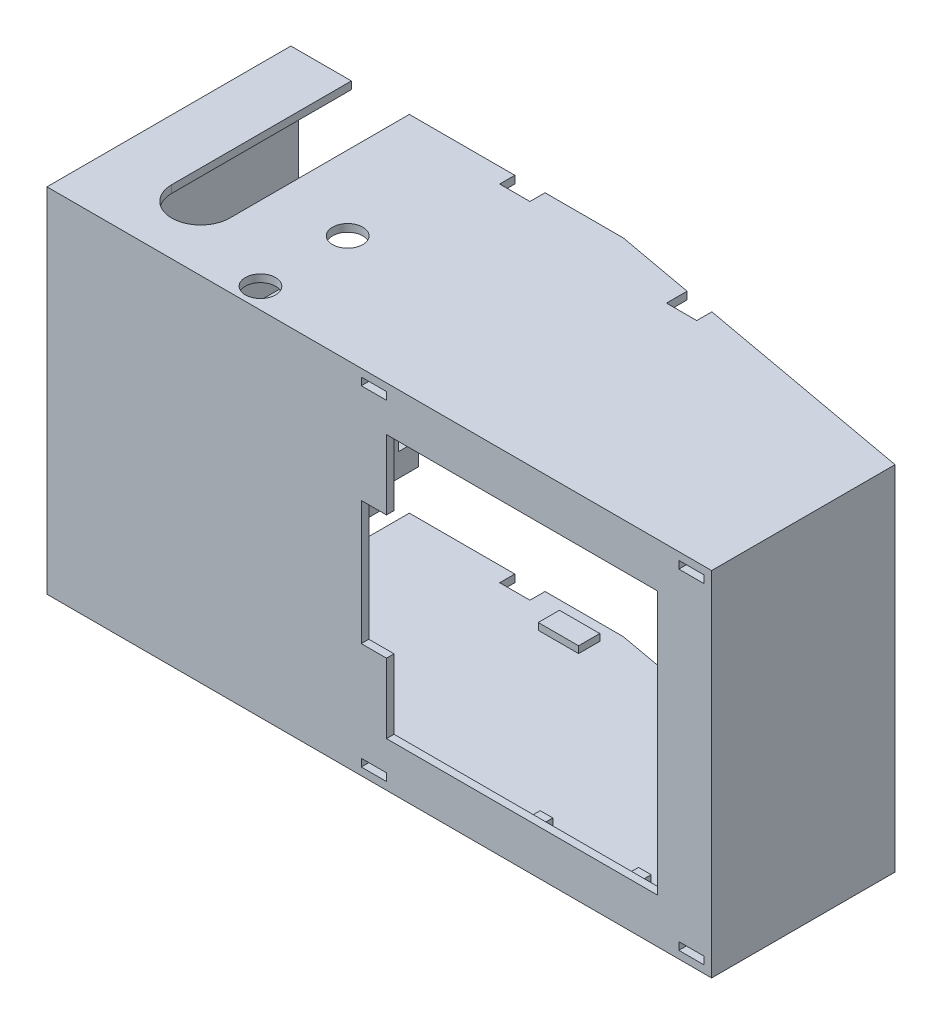
from build123d import *

# Parameters (mm, degrees)
SKETCH1_W                 = 131.85
SKETCH1_H                 = 70
BOSS_EXTRUDE1_DEPTH       = 1.5
SKETCH1_5_W               = 131.85
SKETCH1_5_H               = 70
SKETCH1_5_W_2             = 128.85
SKETCH1_5_H_2             = 67
BOSS_EXTRUDE2_DEPTH       = 46.887495374
SKETCH2_W                 = 5.8
SKETCH2_H                 = 7.525
BOSS_EXTRUDE3_DEPTH       = 67
CAVITY1_START             = -114.930353249
CAVITY1_DEPTH             = 49.266
CAVITY1_2_DEPTH           = 37.332
CAVITY1_START_2           = -120.030353249
CAVITY1_3_OUTLINE_W       = 2.55
CAVITY1_3_OUTLINE_H       = 5.1
CAVITY1_3_DEPTH           = 0.430353249
CAVITY1_START_3           = -9.75
CAVITY1_4_DEPTH           = 70
SKETCH5_W                 = 8.75
SKETCH5_H                 = 5
BOSS_EXTRUDE4_DEPTH       = 22.5
CUT_EXTRUDE3_REACH        = 139.739
SKETCH6_R                 = 1.5
SKETCH6_R_2               = 1
CUT_EXTRUDE18_DEPTH       = 1.15
CUT_EXTRUDE18_DEPTH_BACK  = 1.15
CUT_EXTRUDE18_START       = -2.5
CUT_EXTRUDE19_DEPTH       = 1.15
CUT_EXTRUDE19_DEPTH_BACK  = 1.15
CUT_EXTRUDE19_START       = -19.7
SKETCH9_W                 = 32.1
SKETCH9_H                 = 12.2
SKETCH9_W_2               = 2.6125
BOSS_EXTRUDE5_DEPTH       = 40.087495374
SKETCH10_W                = 22.5
SKETCH10_H                = 15.7
CUT_EXTRUDE6_DEPTH        = 12.2
SKETCH11_R                = 0.75
CUT_EXTRUDE7_DEPTH        = 8
CUT_EXTRUDE9_REACH        = 149.525
SKETCH17_W                = 3.1875
SKETCH17_H                = 12.2
CUT_EXTRUDE13_DEPTH       = 7.525
SKETCH20_W                = 2.5
SKETCH20_H                = 3
BOSSBATTERYSTUBS_DEPTH    = 5.75
MIRROR10_COPY_1_SKETCH_W  = 2.5
MIRROR10_COPY_1_SKETCH_H  = 3
MIRROR10_COPY_1_DEPTH     = 5.75
SKETCH21_W                = 8
SKETCH21_H                = 4.2
BODYTOPCANTPOSBOSS_DEPTH  = 1.35
MIRROR12_COPY_1_SKETCH_W  = 8
MIRROR12_COPY_1_SKETCH_H  = 4.2
MIRROR12_COPY_1_DEPTH     = 1.35
PCBHOLDERCANTNEGCUT_REACH = 145.655
SKETCH22_W                = 5
SKETCH22_H                = 1.5
SKETCH23_W                = 5
SKETCH23_H                = 1.5
CUT_EXTRUDE17_DEPTH       = 3
PCBHOLDERACCESSCUT_REACH  = 145.156
CUT_EXTRUDE15_START       = -5.25
SKETCH19_R                = 3
CUT_EXTRUDE15_DEPTH       = 5.25
CUT_EXTRUDE24_START       = -5.25
SKETCH28_R                = 3
CUT_EXTRUDE24_DEPTH       = 5.25
CUT_EXTRUDE25_REACH       = 118.492
SKETCH29_W                = 8
SKETCH29_H                = 3
SKETCH30_W                = 5.1
SKETCH30_H                = 2.55
BOSSFRONTCAVITYFIX_DEPTH  = 0.430353249
CUT_EXTRUDE26_DEPTH       = 4.8
CUT_EXTRUDE28_REACH       = 154.358
SKETCH33_W                = 3
SKETCH33_H                = 20
BODYTOPCVCUT_DEPTH        = 148.525073199
ATTACHMENTSIDECUT_REACH   = 149.525
SKETCH32_W                = 6
SKETCH32_H                = 3


# Read off the part's stored shape, not the designer's step: Cavity1
with BuildPart() as part:
    # Sketch1 → Boss-Extrude1 (new body)
    with BuildSketch(Plane.XY):
        with Locations((-55.175, 25.25)):
            Rectangle(SKETCH1_W, SKETCH1_H)
    extrude(amount=BOSS_EXTRUDE1_DEPTH)

    # Sketch1<5> → Boss-Extrude2 (add)
    with BuildSketch(Plane.XY):
        with Locations((-55.175, 25.25)):
            Rectangle(SKETCH1_5_W, SKETCH1_5_H)
        with Locations((-55.175, 25.25)):
            Rectangle(SKETCH1_5_W_2, SKETCH1_5_H_2, mode=Mode.SUBTRACT)
    extrude(amount=-BOSS_EXTRUDE2_DEPTH)

    # Sketch2 → Boss-Extrude3 (add)
    with BuildSketch(Plane.XZ.offset(-58.75)):
        with Locations((-76.95, -3.7625)):
            Rectangle(SKETCH2_W, SKETCH2_H)
    extrude(amount=BOSS_EXTRUDE3_DEPTH)

    # Cavity1 outline → Cavity1 (cut)
    with BuildSketch(Plane.YZ.offset(CAVITY1_START)):
        with BuildLine():
            Line((36.166540929, -4.011412776), (36.166540929, -7.525))
            Line((36.166540929, -7.525), (53.710540929, -7.525))
            Line((53.710540929, -7.525), (53.710540929, -4.011412776))
            ThreePointArc((53.710540929, -4.011412776), (44.938540929, 0.123), (36.166540929, -4.011412776))
        make_face()
        with BuildLine():
            Line((14.333459071, -7.525), (14.333459071, -4.011412776))
            ThreePointArc((14.333459071, -4.011412776), (5.561459071, 0.123), (-3.210540929, -4.011412776))
            Line((-3.210540929, -4.011412776), (-3.210540929, -7.525))
            Line((-3.210540929, -7.525), (14.333459071, -7.525))
        make_face()
    extrude(amount=CAVITY1_DEPTH, mode=Mode.SUBTRACT)

    # Cavity1 2 outline → Cavity1 2 (cut)
    with BuildSketch(Plane.YZ.offset(CAVITY1_START)):
        with BuildLine():
            Line((55.189540929, 0.225), (36.166540929, 0.225))
            Line((36.166540929, 0.225), (36.166540929, -4.011412776))
            ThreePointArc((36.166540929, -4.011412776), (44.938540929, 0.123), (53.710540929, -4.011412776))
            Line((53.710540929, -4.011412776), (53.710540929, -7.525))
            Line((53.710540929, -7.525), (55.189540929, -7.525))
            Line((55.189540929, -7.525), (55.189540929, 0.225))
        make_face()
        with BuildLine():
            Line((14.333459071, -4.011412776), (14.333459071, 0.225))
            Line((14.333459071, 0.225), (-4.689540929, 0.225))
            Line((-4.689540929, 0.225), (-4.689540929, -7.525))
            Line((-4.689540929, -7.525), (-3.210540929, -7.525))
            Line((-3.210540929, -7.525), (-3.210540929, -4.011412776))
            ThreePointArc((-3.210540929, -4.011412776), (5.561459071, 0.123), (14.333459071, -4.011412776))
        make_face()
    extrude(amount=CAVITY1_2_DEPTH, mode=Mode.SUBTRACT)

    # Cavity1 3 outline → Cavity1 3 (cut)
    with BuildSketch(Plane.YZ.offset(CAVITY1_START_2)):
        with Locations((44.938540929, -11.25)):
            Rectangle(CAVITY1_3_OUTLINE_W, CAVITY1_3_OUTLINE_H)
        with Locations((5.561459071, -11.25)):
            Rectangle(CAVITY1_3_OUTLINE_W, CAVITY1_3_OUTLINE_H)
    extrude(amount=CAVITY1_3_DEPTH, mode=Mode.SUBTRACT)

    # Cavity1 4 outline → Cavity1 4 (cut)
    with BuildSketch(Plane(origin=(0, 0, 0), x_dir=(1, 0, 0), z_dir=(0, 1, 0)).offset(CAVITY1_START_3)):
        with BuildLine():
            Line((-105.571853249, 13.174532151), (-105.571853249, 9.325467849))
            ThreePointArc((-105.571853249, 9.325467849), (-103.710353249, 8.5725), (-101.848853249, 9.325467849))
            Line((-101.848853249, 9.325467849), (-101.848853249, 13.174532151))
            ThreePointArc((-101.848853249, 13.174532151), (-103.710353249, 13.9275), (-105.571853249, 13.174532151))
        make_face()
    extrude(amount=CAVITY1_4_DEPTH, mode=Mode.SUBTRACT)

    # Sketch5 → Boss-Extrude4 (add)
    with BuildSketch(Plane(origin=(0, 0, 0), x_dir=(-1, 0, 0), z_dir=(0, 0, -1))):
        with Locations((82.85, 33.85)):
            Rectangle(SKETCH5_W, SKETCH5_H)
    boss_extrude4 = extrude(amount=BOSS_EXTRUDE4_DEPTH)

    # Sketch6 → Cut-Extrude3 (cut, up to next)
    with BuildSketch(Plane(origin=(0, 36.166540929, 0), x_dir=(1, 0, 0), z_dir=(0, 1, 0)), mode=Mode.PRIVATE) as cut_extrude3_sk1:
        with Locations(Location((-82.85, 19.9, 0), (0, 0, 270))):
            Circle(SKETCH6_R)
    cut_extrude3_tool1 = extrude(cut_extrude3_sk1.sketch, amount=-CUT_EXTRUDE3_REACH, mode=Mode.PRIVATE) & part.part
    # Sketch6 → Cut-Extrude3 (cut, up to next)
    with BuildSketch(Plane(origin=(0, 36.166540929, 0), x_dir=(1, 0, 0), z_dir=(0, 1, 0)), mode=Mode.PRIVATE) as cut_extrude3_sk2:
        with Locations(Location((-82.85, 2.6, 0), (0, 0, 270))):
            Circle(SKETCH6_R_2)
    cut_extrude3_tool2 = extrude(cut_extrude3_sk2.sketch, amount=-CUT_EXTRUDE3_REACH, mode=Mode.PRIVATE) & part.part
    cut_extrude3_1 = cut_extrude3_tool1.solids().sort_by_distance((-82.85, 36.166541, -19.9))[0]
    add(cut_extrude3_1, mode=Mode.SUBTRACT)
    cut_extrude3_2 = cut_extrude3_tool2.solids().sort_by_distance((-82.85, 36.166541, -2.6))[0]
    add(cut_extrude3_2, mode=Mode.SUBTRACT)
    cut_extrude3 = cut_extrude3_1 + cut_extrude3_2  # Cut-Extrude3 as one shape, for the pattern or mirror that repeats it

    # Sketch24 → Cut-Extrude18 (cut, two sides: drawn at the far end of the back side and taken through both)
    with BuildSketch(Plane(origin=(0, 36.35, 0), x_dir=(1, 0, 0), z_dir=(0, 1, 0)).offset(CUT_EXTRUDE18_START - CUT_EXTRUDE18_DEPTH_BACK)):
        Polygon((-82.85, 16.637970979), (-80.025, 18.26898549), (-80.025, 22.5), (-85.675, 22.5), (-85.675, 18.26898549), align=None)
    extrude(amount=CUT_EXTRUDE18_DEPTH + CUT_EXTRUDE18_DEPTH_BACK, mode=Mode.SUBTRACT)

    # Mirror15: Boss-Extrude4, Cut-Extrude3 across plane
    add(boss_extrude4.mirror(Plane(origin=(0, 25.25, 0), x_dir=(0, 0, 1), z_dir=(0, -1, 0))))
    add(cut_extrude3.mirror(Plane(origin=(0, 25.25, 0), x_dir=(0, 0, 1), z_dir=(0, -1, 0))), mode=Mode.SUBTRACT)

    # Sketch24<2> → Cut-Extrude19 (cut, two sides: drawn at the far end of the back side and taken through both)
    with BuildSketch(Plane(origin=(0, 36.35, 0), x_dir=(1, 0, 0), z_dir=(0, 1, 0)).offset(CUT_EXTRUDE19_START - CUT_EXTRUDE19_DEPTH_BACK)):
        Polygon((-82.85, 16.637970979), (-80.025, 18.26898549), (-80.025, 22.5), (-85.675, 22.5), (-85.675, 18.26898549), align=None)
    extrude(amount=CUT_EXTRUDE19_DEPTH + CUT_EXTRUDE19_DEPTH_BACK, mode=Mode.SUBTRACT)

    # Sketch9 → Boss-Extrude5 (add)
    with BuildSketch(Plane(origin=(0, 0, 0), x_dir=(-1, 0, 0), z_dir=(0, 0, -1))):
        with Locations((93.2875, 25.25)):
            Rectangle(SKETCH9_W, SKETCH9_H)
        with Locations((78.54375, 25.25)):
            Rectangle(SKETCH9_W_2, SKETCH9_H)
    extrude(amount=BOSS_EXTRUDE5_DEPTH)

    # Sketch10 → Cut-Extrude6 (cut)
    with BuildSketch(Plane(origin=(0, 31.35, 0), x_dir=(1, 0, 0), z_dir=(0, 1, 0))):
        with Locations((-93.2875, 32.237495374)):
            Rectangle(SKETCH10_W, SKETCH10_H)
    extrude(amount=-CUT_EXTRUDE6_DEPTH, mode=Mode.SUBTRACT)

    # Sketch11 → Cut-Extrude7 (cut)
    with BuildSketch(Plane(origin=(0, 0, -40.087495374), x_dir=(-1, 0, 0), z_dir=(0, 0, -1))):
        with Locations((106.9375, 25.25)):
            Circle(SKETCH11_R)
    cut_extrude7 = extrude(amount=-CUT_EXTRUDE7_DEPTH, mode=Mode.SUBTRACT)

    # Sketch13 → Cut-Extrude9 (cut, up to next)
    with BuildSketch(Plane(origin=(0, 60.25, 0), x_dir=(1, 0, 0), z_dir=(0, 1, 0)), mode=Mode.PRIVATE) as cut_extrude9_sk1:
        with BuildLine():
            Line((-109.1, 46.887495374), (-109.1, 11.25))
            ThreePointArc((-109.1, 11.25), (-103.35, 5.5), (-97.6, 11.25))
            Line((-97.6, 11.25), (-97.6, 46.887495374))
            Line((-97.6, 46.887495374), (-109.1, 46.887495374))
        make_face()
        with BuildLine():
            Line((-105.571853249, 9.325467849), (-105.571853249, 13.174532151))
            ThreePointArc((-105.571853249, 13.174532151), (-103.710353249, 13.9275), (-101.848853249, 13.174532151))
            Line((-101.848853249, 13.174532151), (-101.848853249, 9.325467849))
            ThreePointArc((-101.848853249, 9.325467849), (-103.710353249, 8.5725), (-105.571853249, 9.325467849))
        make_face(mode=Mode.SUBTRACT)
    cut_extrude9_tool1 = extrude(cut_extrude9_sk1.sketch, amount=-CUT_EXTRUDE9_REACH, mode=Mode.PRIVATE) & part.part
    cut_extrude9 = cut_extrude9_tool1.solids().sort_by_distance((-103.335225, 60.25, -27.427392))[0]
    add(cut_extrude9, mode=Mode.SUBTRACT)

    # Mirror4: Cut-Extrude9 across plane
    add(cut_extrude9.mirror(Plane(origin=(0, 25.25, 0), x_dir=(0, 0, 1), z_dir=(0, -1, 0))), mode=Mode.SUBTRACT)

    # Sketch17 → Cut-Extrude13 (cut)
    with BuildSketch(Plane(origin=(0, 0, -7.525), x_dir=(-1, 0, 0), z_dir=(0, 0, -1))):
        with Locations((75.64375, 25.25)):
            Rectangle(SKETCH17_W, SKETCH17_H)
    extrude(amount=-CUT_EXTRUDE13_DEPTH, mode=Mode.SUBTRACT)

    # Sketch20 → BossBatteryStubs (add)
    with BuildSketch(Plane(origin=(0, 0, 0), x_dir=(-1, 0, 0), z_dir=(0, 0, -1))):
        with Locations((29.25, 57.25)):
            Rectangle(SKETCH20_W, SKETCH20_H)
    bossbatterystubs = extrude(amount=BOSSBATTERYSTUBS_DEPTH)

    # Mirror9: BossBatteryStubs across plane
    add(bossbatterystubs.mirror(Plane.ZY.offset(19.5)))

    # Mirror10: BossBatteryStubs across plane
    add(bossbatterystubs.mirror(Plane(origin=(0, 25.25, 0), x_dir=(0, 0, 1), z_dir=(0, -1, 0))))

    # Mirror10 copy 1 sketch → Mirror10 copy 1 (add)
    with BuildSketch(Plane(origin=(-39, 50.5, 0), x_dir=(1, 0, 0), z_dir=(0, 0, -1))):
        with Locations((29.25, 57.25)):
            Rectangle(MIRROR10_COPY_1_SKETCH_W, MIRROR10_COPY_1_SKETCH_H)
    extrude(amount=MIRROR10_COPY_1_DEPTH)

    # Sketch21 → bodyTopCantPosBoss (add)
    with BuildSketch(Plane.XZ.offset(-58.75)):
        with Locations((-115.6, -41.637495374)):
            Rectangle(SKETCH21_W, SKETCH21_H)
    bodytopcantposboss = extrude(amount=BODYTOPCANTPOSBOSS_DEPTH)

    # Mirror11: bodyTopCantPosBoss across plane
    add(bodytopcantposboss.mirror(Plane(origin=(-88.1375, 0, 0), x_dir=(0, 0, 1), z_dir=(1, 0, 0))))

    # Mirror12: bodyTopCantPosBoss across plane
    add(bodytopcantposboss.mirror(Plane(origin=(0, 25.25, 0), x_dir=(0, 0, 1), z_dir=(0, -1, 0))))

    # Mirror12 copy 1 sketch → Mirror12 copy 1 (add)
    with BuildSketch(Plane(origin=(-176.275, -8.25, 0), x_dir=(-1, 0, 0), z_dir=(0, 1, 0))):
        with Locations((-115.6, -41.637495374)):
            Rectangle(MIRROR12_COPY_1_SKETCH_W, MIRROR12_COPY_1_SKETCH_H)
    extrude(amount=MIRROR12_COPY_1_DEPTH)

    # Sketch22 → pcbHolderCantNegCut (cut, up to next)
    with BuildSketch(Plane.XY.offset(1.5), mode=Mode.PRIVATE) as pcbholdercantnegcut_sk1:
        with Locations((6.75, 58)):
            Rectangle(SKETCH22_W, SKETCH22_H)
    pcbholdercantnegcut_tool1 = extrude(pcbholdercantnegcut_sk1.sketch, amount=-PCBHOLDERCANTNEGCUT_REACH, mode=Mode.PRIVATE) & part.part
    pcbholdercantnegcut = pcbholdercantnegcut_tool1.solids().sort_by_distance((6.75, 58, 1.5))[0]
    add(pcbholdercantnegcut, mode=Mode.SUBTRACT)

    # Sketch23 → Cut-Extrude17 (cut)
    with BuildSketch(Plane.XY.offset(1.5)):
        with Locations((-56.25, 58)):
            Rectangle(SKETCH23_W, SKETCH23_H)
    cut_extrude17 = extrude(amount=-CUT_EXTRUDE17_DEPTH, mode=Mode.SUBTRACT)

    # Mirror13: pcbHolderCantNegCut, Cut-Extrude17 across plane
    add(pcbholdercantnegcut.mirror(Plane(origin=(0, 25.25, 0), x_dir=(0, 0, 1), z_dir=(0, -1, 0))), mode=Mode.SUBTRACT)
    add(cut_extrude17.mirror(Plane(origin=(0, 25.25, 0), x_dir=(0, 0, 1), z_dir=(0, -1, 0))), mode=Mode.SUBTRACT)

    # Mirror14: Cut-Extrude7 across plane
    add(cut_extrude7.mirror(Plane(origin=(-93.2875, 0, 0), x_dir=(0, 0, 1), z_dir=(1, 0, 0))), mode=Mode.SUBTRACT)

    # Sketch27 → pcbHolderAccessCut (cut, up to next)
    with BuildSketch(Plane(origin=(0, 0, 0), x_dir=(-1, 0, 0), z_dir=(0, 0, -1)), mode=Mode.PRIVATE) as pcbholderaccesscut_sk1:
        Polygon((58.75, 37.55), (58.75, 12.95), (53.75, 12.95), (53.75, -0.875), (0, -0.875), (0, 51.375), (53.75, 51.375), (53.75, 37.55), align=None)
    pcbholderaccesscut_tool1 = extrude(pcbholderaccesscut_sk1.sketch, amount=-PCBHOLDERACCESSCUT_REACH, mode=Mode.PRIVATE) & part.part
    add(pcbholderaccesscut_tool1.solids().sort_by_distance((-28.107544, 25.25, 0))[0], mode=Mode.SUBTRACT)

    # Sketch19 → Cut-Extrude15 (cut)
    with BuildSketch(Plane.XZ.offset(9.75).offset(CUT_EXTRUDE15_START)):
        with Locations((-82.85, -19.9)):
            Circle(SKETCH19_R)
        with Locations((-82.85, -2.6)):
            Circle(SKETCH19_R)
    extrude(amount=CUT_EXTRUDE15_DEPTH, mode=Mode.SUBTRACT)

    # Sketch28 → Cut-Extrude24 (cut)
    with BuildSketch(Plane(origin=(0, 60.25, 0), x_dir=(1, 0, 0), z_dir=(0, 1, 0)).offset(CUT_EXTRUDE24_START)):
        with Locations((-82.85, 19.9)):
            Circle(SKETCH28_R)
        with Locations((-82.85, 2.6)):
            Circle(SKETCH28_R)
    extrude(amount=CUT_EXTRUDE24_DEPTH, mode=Mode.SUBTRACT)

    # Sketch29 → Cut-Extrude25 (cut, up to next)
    with BuildSketch(Plane(origin=(-77.2375, 0, 0), x_dir=(0, 0, -1), z_dir=(1, 0, 0)), mode=Mode.PRIVATE) as cut_extrude25_sk1:
        with Locations((28.387495374, 25.25)):
            Rectangle(SKETCH29_W, SKETCH29_H)
    cut_extrude25_tool1 = extrude(cut_extrude25_sk1.sketch, amount=-CUT_EXTRUDE25_REACH, mode=Mode.PRIVATE) & part.part
    add(cut_extrude25_tool1.solids().sort_by_distance((-77.2375, 25.25, -28.387495))[0], mode=Mode.SUBTRACT)

    # Sketch30 → BossFrontCavityFix (add)
    with BuildSketch(Plane(origin=(-120.030353249, 0, 0), x_dir=(0, 0, -1), z_dir=(1, 0, 0))):
        with Locations((11.25, 44.938540929)):
            Rectangle(SKETCH30_W, SKETCH30_H)
        with Locations((11.25, 5.561459071)):
            Rectangle(SKETCH30_W, SKETCH30_H)
    extrude(amount=BOSSFRONTCAVITYFIX_DEPTH)

    # Sketch31 → Cut-Extrude26 (cut)
    with BuildSketch(Plane(origin=(-77.2375, 0, 0), x_dir=(0, 0, -1), z_dir=(1, 0, 0))):
        Polygon((40.087495374, 19.15), (28.387495374, 19.15), (28.387495374, 23.75), (28.387495374, 26.75), (28.387495374, 31.35), (40.087495374, 31.35), align=None)
    extrude(amount=-CUT_EXTRUDE26_DEPTH, mode=Mode.SUBTRACT)

    # Sketch33 → Cut-Extrude28 (cut, up to next)
    with BuildSketch(Plane(origin=(10.75, 0, 0), x_dir=(0, 0, -1), z_dir=(1, 0, 0)), mode=Mode.PRIVATE) as cut_extrude28_sk1:
        with Locations((45.387495374, 25.25)):
            Rectangle(SKETCH33_W, SKETCH33_H)
    cut_extrude28_tool1 = extrude(cut_extrude28_sk1.sketch, amount=-CUT_EXTRUDE28_REACH, mode=Mode.PRIVATE) & part.part
    cut_extrude28 = cut_extrude28_tool1.solids().sort_by_distance((10.75, 25.25, -45.387495))[0]
    add(cut_extrude28, mode=Mode.SUBTRACT)

    # Mirror17: Cut-Extrude28 across plane
    add(cut_extrude28.mirror(Plane(origin=(-55.175, 0, 0), x_dir=(0, 0, 1), z_dir=(1, 0, 0))), mode=Mode.SUBTRACT)

    # Sketch35 → bodyTopCVCut (cut, through all)
    with BuildSketch(Plane(origin=(0, 60.25, 0), x_dir=(1, 0, 0), z_dir=(0, 1, 0))):
        Polygon((-55.175, 46.887495374), (10.75, 34.887495374), (10.75, 46.887495374), align=None)
    extrude(amount=-BODYTOPCVCUT_DEPTH, mode=Mode.SUBTRACT)

    # Sketch32 → attachmentSideCut (cut, up to next)
    with BuildSketch(Plane.XZ.offset(9.75), mode=Mode.PRIVATE) as attachmentsidecut_sk1:
        with Locations((-73.675, -45.387495374)):
            Rectangle(SKETCH32_W, SKETCH32_H)
    attachmentsidecut_tool1 = extrude(attachmentsidecut_sk1.sketch, amount=-ATTACHMENTSIDECUT_REACH, mode=Mode.PRIVATE) & part.part
    # Sketch32 → attachmentSideCut (cut, up to next)
    with BuildSketch(Plane.XZ.offset(9.75), mode=Mode.PRIVATE) as attachmentsidecut_sk2:
        Polygon((-33.675, -42.973957262), (-33.675, -39.973957262), (-39.675, -39.973957262), (-39.675, -42.973957262), (-39.675, -44.066107433), align=None)
    attachmentsidecut_tool2 = extrude(attachmentsidecut_sk2.sketch, amount=-ATTACHMENTSIDECUT_REACH, mode=Mode.PRIVATE) & part.part
    attachmentsidecut_1 = attachmentsidecut_tool1.solids().sort_by_distance((-73.675, -9.75, -45.387495))[0]
    add(attachmentsidecut_1, mode=Mode.SUBTRACT)
    attachmentsidecut_2 = attachmentsidecut_tool2.solids().sort_by_distance((-36.828994, -9.75, -41.76101))[0]
    add(attachmentsidecut_2, mode=Mode.SUBTRACT)
    attachmentsidecut = attachmentsidecut_1 + attachmentsidecut_2  # attachmentSideCut as one shape, for the pattern or mirror that repeats it

    # Mirror16: attachmentSideCut across plane
    add(attachmentsidecut.mirror(Plane(origin=(0, 25.25, 0), x_dir=(0, 0, 1), z_dir=(0, -1, 0))), mode=Mode.SUBTRACT)


solid = part.part
